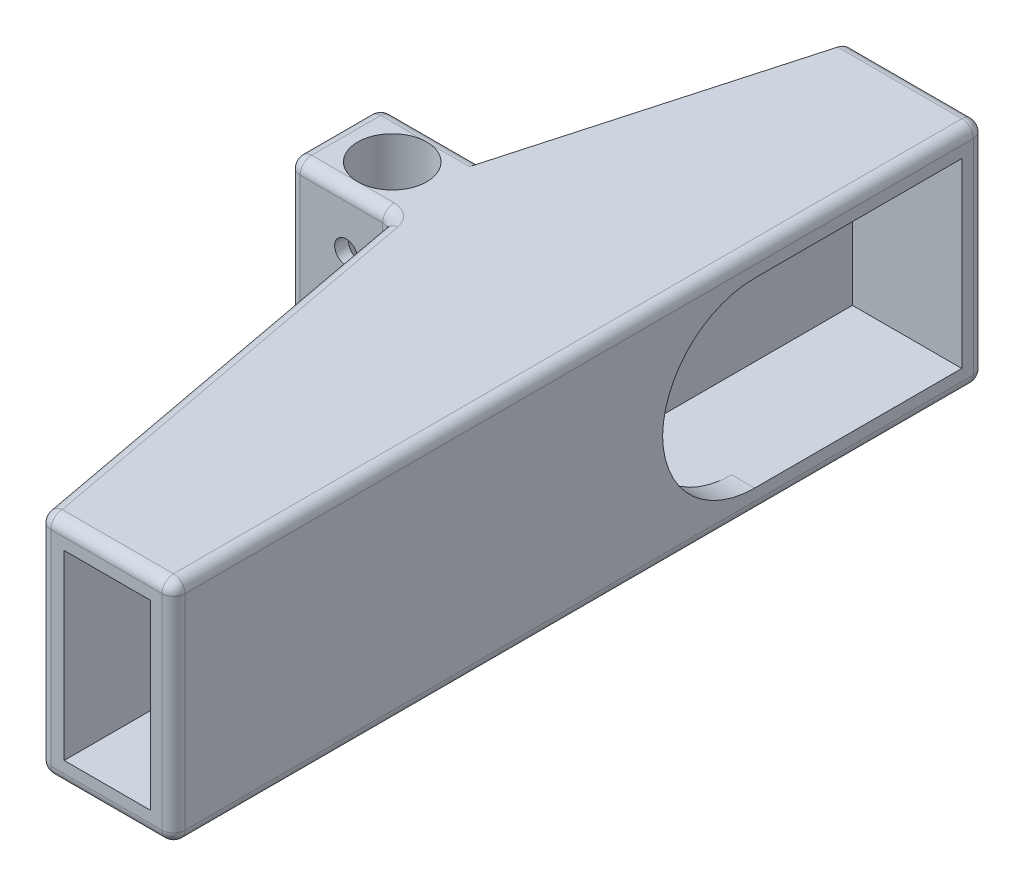
from build123d import *

# Parameters (mm, degrees)
CROQUIS1_W                 = 19.8
CROQUIS1_H                 = 11.5
SALIENTE_EXTRUIR1_DEPTH    = 70.5
VACIADO1_T                 = -2
CROQUIS5_W                 = 15.8
CROQUIS5_H                 = 2
SALIENTE_EXTRUIR2_DEPTH    = 2
CROQUIS6_W                 = 19.8
CROQUIS6_H                 = 8
SALIENTE_EXTRUIR4_DEPTH    = 16
SALIENTE_EXTRUIR5_DEPTH    = 19.8
CROQUIS10_R                = 3
CORTAR_EXTRUIR4_DEPTH      = 19.8
CORTAR_EXTRUIR3_DEPTH      = 43.653516854
CORTAR_EXTRUIR3_DEPTH_BACK = 43.653516854
CROQUIS8_R                 = 1
CROQUIS11_W                = 15.8
CROQUIS11_H                = 26
CORTAR_EXTRUIR5_DEPTH      = 2
REDONDEO2_R                = 8
REDONDEO4_R                = 1
REDONDEO5_R                = 1
REDONDEO6_R                = 1
REDONDEO7_R                = 1
REDONDEO8_R                = 1


# Some blends are built 0.0001 mm under size
with BuildPart() as part:
    # Croquis1 → Saliente-Extruir1 (new body)
    with BuildSketch(Plane(origin=(0, 0, 0), x_dir=(0, 1, 0), z_dir=(0, 0, 1))):
        Rectangle(CROQUIS1_W, CROQUIS1_H)
    extrude(amount=SALIENTE_EXTRUIR1_DEPTH)

    # Vaciado1
    vaciado1_openings = [part.faces().sort_by_distance(p)[0] for p in [
        (0, 0, 70.5),
    ]]
    offset(amount=VACIADO1_T, openings=vaciado1_openings, kind=Kind.INTERSECTION)

    # Croquis5 → Saliente-Extruir2 (add)
    with BuildSketch(Plane.YZ.offset(5.75)):
        with Locations((0, 69.5)):
            Rectangle(CROQUIS5_W, CROQUIS5_H)
    extrude(amount=-SALIENTE_EXTRUIR2_DEPTH)

    # Croquis6 → Saliente-Extruir4 (add)
    with BuildSketch(Plane(origin=(-5.75, 0, 0), x_dir=(0, -1, 0), z_dir=(-1, 0, 0))):
        with Locations((0, 29)):
            Rectangle(CROQUIS6_W, CROQUIS6_H)
    extrude(amount=SALIENTE_EXTRUIR4_DEPTH)

    # Croquis9 → Saliente-Extruir5 (add)
    with BuildSketch(Plane.XZ.offset(9.9)):
        Polygon((-5.75, 70.5), (-12.75, 33), (-5.75, 33), align=None)
        Polygon((-5.75, 0), (-12.75, 25), (-5.75, 25), align=None)
    extrude(amount=-SALIENTE_EXTRUIR5_DEPTH)

    # Croquis10 → Cortar-Extruir4 (cut)
    with BuildSketch(Plane.XZ.offset(9.9)):
        with Locations(Location((-16.745253682, 29, 0), (0, 0, 270))):
            Circle(CROQUIS10_R)
    extrude(amount=-CORTAR_EXTRUIR4_DEPTH, mode=Mode.SUBTRACT)

    # Croquis8 → Cortar-Extruir3 (cut, two sides: drawn at the far end of the back side and taken through both)
    with BuildSketch(Plane(origin=(-4, 0, 33), x_dir=(1, 0, 0), z_dir=(0, 0, 1)).offset(-CORTAR_EXTRUIR3_DEPTH_BACK)):
        with Locations((-12.75, 5.1)):
            Circle(CROQUIS8_R)
        with Locations((-12.75, -4.9)):
            Circle(CROQUIS8_R)
    extrude(amount=CORTAR_EXTRUIR3_DEPTH + CORTAR_EXTRUIR3_DEPTH_BACK, mode=Mode.SUBTRACT)

    # Croquis11 → Cortar-Extruir5 (cut)
    with BuildSketch(Plane.YZ.offset(5.75)):
        with Locations((0, 15)):
            Rectangle(CROQUIS11_W, CROQUIS11_H)
    extrude(amount=-CORTAR_EXTRUIR5_DEPTH, mode=Mode.SUBTRACT)

    # Redondeo2
    # the kernel refuses this fillet: 8 mm, written as the material it adds along each edge
    with BuildSketch(Plane(origin=(5.75, -7.9, 28), x_dir=(0, 1, 0), z_dir=(-1, 0, 0)), Plane(origin=(5.75, 7.9, 28), x_dir=(0, 0, -1), z_dir=(-1, 0, 0))) as redondeo2_piece_1:
        with BuildLine():
            CenterArc((REDONDEO2_R, REDONDEO2_R), REDONDEO2_R, 180, 90)
            Line((0, REDONDEO2_R), (0, 0))
            Line((0, 0), (REDONDEO2_R, 0))
        make_face()
    extrude(amount=2)

    # Redondeo4
    redondeo4_edges = [part.edges().sort_by_distance(p)[0] for p in [
        (-12.75, 0, 33),
    ]]
    fillet(redondeo4_edges, radius=REDONDEO4_R)

    # Redondeo5
    redondeo5_edges = [part.edges().sort_by_distance(p)[0] for p in [
        (5.75, 0, 70.5),
        (-5.75, 0, 70.5),
    ]]
    fillet(redondeo5_edges, radius=REDONDEO5_R)

    # Redondeo6
    redondeo6_edges = [part.edges().sort_by_distance(p)[0] for p in [
        (-12.941660805, -9.9, 33.230748054),
        (-12.941660805, 9.9, 33.230748054),
        (-9.25, 9.9, 51.75),
        (-9.25, -9.9, 51.75),
        (-0.084696812, 9.9, 70.5),
        (5.75, 9.9, 34.75),
        (5.457106781, 9.9, 70.207106781),
        (-5.558339195, 9.9, 70.269251946),
        (-0.084696812, -9.9, 70.5),
        (5.75, -9.9, 34.75),
        (5.457106781, -9.9, 70.207106781),
        (-5.558339195, -9.9, 70.269251946),
        (-17.665303188, 9.9, 33),
        (-17.665303188, -9.9, 33),
    ]]
    fillet(redondeo6_edges, radius=REDONDEO6_R - 0.0001)  # a hair under: the kernel refuses the full size

    # Redondeo7
    redondeo7_edges = [part.edges().sort_by_distance(p)[0] for p in [
        (-0.49995, 9.9, 0),
        (5.75, 0, 0),
        (-0.49995, -9.9, 0),
        (5.457136071, -9.607136071, 0),
        (5.457136071, 9.607136071, 0),
        (-21.75, 0, 25),
    ]]
    fillet(redondeo7_edges, radius=REDONDEO7_R - 0.0001)  # a hair under: the kernel refuses the full size

    # Redondeo8
    redondeo8_edges = [part.edges().sort_by_distance(p)[0] for p in [
        (-21.75, 9.9, 29),
        (-21.75, 0, 33),
        (-21.75, -9.607136071, 32.707136071),
        (-21.75, 9.607136071, 32.707136071),
        (-21.75, -9.9, 29),
        (-16.75005, -9.9, 25),
        (-21.457136071, -9.9, 25.292863929),
        (-16.75005, 9.9, 25),
        (-21.457136071, 9.9, 25.292863929),
    ]]
    fillet(redondeo8_edges, radius=REDONDEO8_R - 0.0001)  # a hair under: the kernel refuses the full size


solid = part.part
